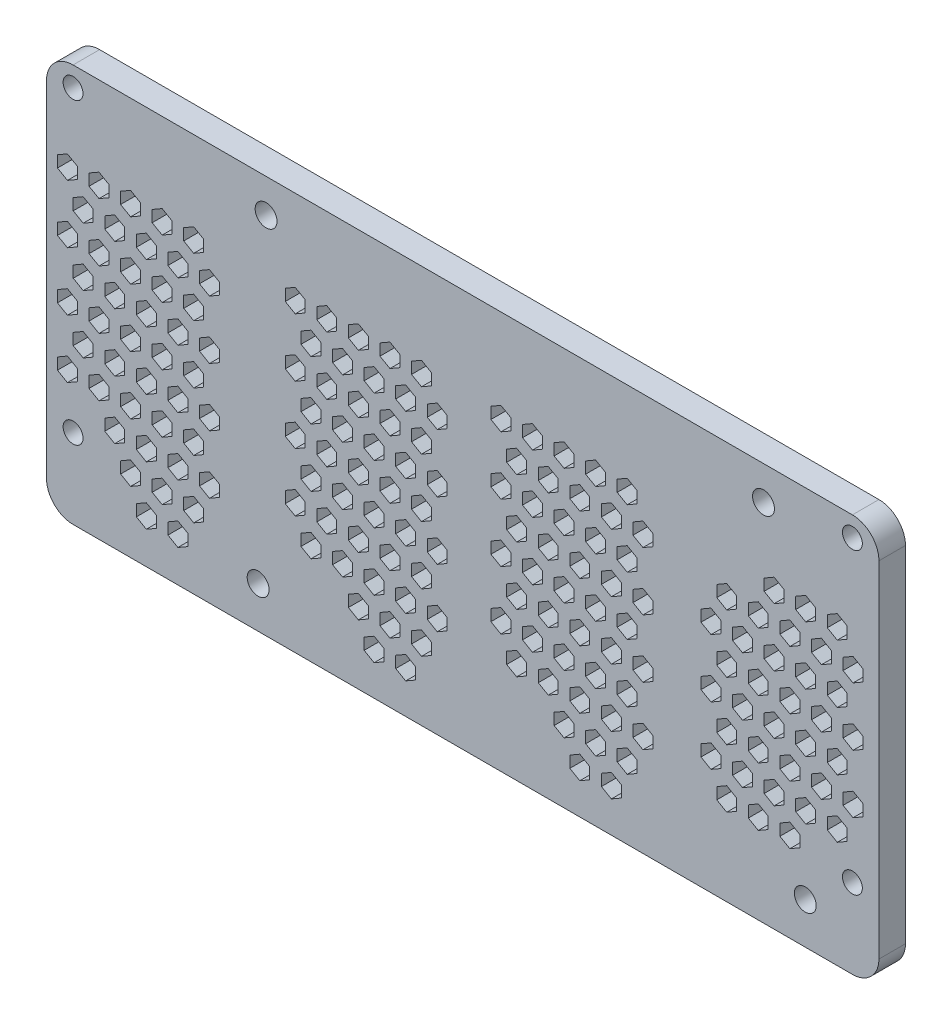
from build123d import *

# Parameters (mm, degrees)
SKETCH1_R           = 1.5
SKETCH1_R_2         = 1.65
BOSS_EXTRUDE5_DEPTH = 4


with BuildPart() as part:
    # Sketch1 → Boss-Extrude5 (new body)
    with BuildSketch(Plane.XY):
        with BuildLine():
            Line((-44, 25.588243638), (73.5, 25.588243638))
            ThreePointArc((73.5, 25.588243638), (76.328427125, 24.416670763), (77.5, 21.588243638))
            Line((77.5, 21.588243638), (77.5, -30.415198275))
            ThreePointArc((77.5, -30.415198275), (76.328427125, -33.2436254), (73.5, -34.415198275))
            Line((73.5, -34.415198275), (-44, -34.415198275))
            ThreePointArc((-44, -34.415198275), (-46.828427125, -33.2436254), (-48, -30.415198275))
            Line((-48, -30.415198275), (-48, 21.588243638))
            ThreePointArc((-48, 21.588243638), (-46.828427125, 24.416670763), (-44, 25.588243638))
        make_face()
        with Locations((-44, 22.588243638)):
            Circle(SKETCH1_R, mode=Mode.SUBTRACT)
        with Locations((73.5, 22.588243638)):
            Circle(SKETCH1_R, mode=Mode.SUBTRACT)
        with Locations((-44, -22.411756362)):
            Circle(SKETCH1_R, mode=Mode.SUBTRACT)
        with Locations((73.5, -22.411756362)):
            Circle(SKETCH1_R, mode=Mode.SUBTRACT)
        with Locations((-14.9, 20.514801725)):
            Circle(SKETCH1_R_2, mode=Mode.SUBTRACT)
        with Locations((-16.1, -28.185198275)):
            Circle(SKETCH1_R_2, mode=Mode.SUBTRACT)
        with Locations((60.1, 20.514801725)):
            Circle(SKETCH1_R_2, mode=Mode.SUBTRACT)
        with Locations((66.4, -28.185198275)):
            Circle(SKETCH1_R_2, mode=Mode.SUBTRACT)
        Polygon((-44.8542361, 13.546846171), (-46.3542361, 12.680820767), (-46.3542361, 10.948769959), (-44.8542361, 10.082744555), (-43.3542361, 10.948769959), (-43.3542361, 12.680820767), align=None, mode=Mode.SUBTRACT)
        Polygon((-42.478591753, 9.144922382), (-43.978591753, 8.278896978), (-43.978591753, 6.546846171), (-42.478591753, 5.680820767), (-40.978591753, 6.546846171), (-40.978591753, 8.278896978), align=None, mode=Mode.SUBTRACT)
        Polygon((-40.0942361, 13.546846171), (-41.5942361, 12.680820767), (-41.5942361, 10.948769959), (-40.0942361, 10.082744555), (-38.5942361, 10.948769959), (-38.5942361, 12.680820767), align=None, mode=Mode.SUBTRACT)
        Polygon((-37.718591753, 9.144922382), (-39.218591753, 8.278896978), (-39.218591753, 6.546846171), (-37.718591753, 5.680820767), (-36.218591753, 6.546846171), (-36.218591753, 8.278896978), align=None, mode=Mode.SUBTRACT)
        Polygon((-35.3342361, 13.546846171), (-36.8342361, 12.680820767), (-36.8342361, 10.948769959), (-35.3342361, 10.082744555), (-33.8342361, 10.948769959), (-33.8342361, 12.680820767), align=None, mode=Mode.SUBTRACT)
        Polygon((-32.958591753, 9.144922382), (-34.458591753, 8.278896978), (-34.458591753, 6.546846171), (-32.958591753, 5.680820767), (-31.458591753, 6.546846171), (-31.458591753, 8.278896978), align=None, mode=Mode.SUBTRACT)
        Polygon((-30.5742361, 13.546846171), (-32.0742361, 12.680820767), (-32.0742361, 10.948769959), (-30.5742361, 10.082744555), (-29.0742361, 10.948769959), (-29.0742361, 12.680820767), align=None, mode=Mode.SUBTRACT)
        Polygon((-28.198591753, 9.144922382), (-29.698591753, 8.278896978), (-29.698591753, 6.546846171), (-28.198591753, 5.680820767), (-26.698591753, 6.546846171), (-26.698591753, 8.278896978), align=None, mode=Mode.SUBTRACT)
        Polygon((-25.8142361, 13.546846171), (-27.3142361, 12.680820767), (-27.3142361, 10.948769959), (-25.8142361, 10.082744555), (-24.3142361, 10.948769959), (-24.3142361, 12.680820767), align=None, mode=Mode.SUBTRACT)
        Polygon((-23.438591753, 9.144922382), (-24.938591753, 8.278896978), (-24.938591753, 6.546846171), (-23.438591753, 5.680820767), (-21.938591753, 6.546846171), (-21.938591753, 8.278896978), align=None, mode=Mode.SUBTRACT)
        Polygon((-40.0942361, 4.746846171), (-41.5942361, 3.880820767), (-41.5942361, 2.148769959), (-40.0942361, 1.282744555), (-38.5942361, 2.148769959), (-38.5942361, 3.880820767), align=None, mode=Mode.SUBTRACT)
        Polygon((-37.718591753, 0.344922382), (-39.218591753, -0.521103022), (-39.218591753, -2.253153829), (-37.718591753, -3.119179233), (-36.218591753, -2.253153829), (-36.218591753, -0.521103022), align=None, mode=Mode.SUBTRACT)
        Polygon((-35.3342361, 4.746846171), (-36.8342361, 3.880820767), (-36.8342361, 2.148769959), (-35.3342361, 1.282744555), (-33.8342361, 2.148769959), (-33.8342361, 3.880820767), align=None, mode=Mode.SUBTRACT)
        Polygon((-32.958591753, 0.344922382), (-34.458591753, -0.521103022), (-34.458591753, -2.253153829), (-32.958591753, -3.119179233), (-31.458591753, -2.253153829), (-31.458591753, -0.521103022), align=None, mode=Mode.SUBTRACT)
        Polygon((-30.5742361, 4.746846171), (-32.0742361, 3.880820767), (-32.0742361, 2.148769959), (-30.5742361, 1.282744555), (-29.0742361, 2.148769959), (-29.0742361, 3.880820767), align=None, mode=Mode.SUBTRACT)
        Polygon((-28.198591753, 0.344922382), (-29.698591753, -0.521103022), (-29.698591753, -2.253153829), (-28.198591753, -3.119179233), (-26.698591753, -2.253153829), (-26.698591753, -0.521103022), align=None, mode=Mode.SUBTRACT)
        Polygon((-25.8142361, 4.746846171), (-27.3142361, 3.880820767), (-27.3142361, 2.148769959), (-25.8142361, 1.282744555), (-24.3142361, 2.148769959), (-24.3142361, 3.880820767), align=None, mode=Mode.SUBTRACT)
        Polygon((-23.438591753, 0.344922382), (-24.938591753, -0.521103022), (-24.938591753, -2.253153829), (-23.438591753, -3.119179233), (-21.938591753, -2.253153829), (-21.938591753, -0.521103022), align=None, mode=Mode.SUBTRACT)
        Polygon((-40.0942361, -4.053153829), (-41.5942361, -4.919179233), (-41.5942361, -6.651230041), (-40.0942361, -7.517255445), (-38.5942361, -6.651230041), (-38.5942361, -4.919179233), align=None, mode=Mode.SUBTRACT)
        Polygon((-37.718591753, -8.455077618), (-39.218591753, -9.321103022), (-39.218591753, -11.053153829), (-37.718591753, -11.919179233), (-36.218591753, -11.053153829), (-36.218591753, -9.321103022), align=None, mode=Mode.SUBTRACT)
        Polygon((-35.3342361, -4.053153829), (-36.8342361, -4.919179233), (-36.8342361, -6.651230041), (-35.3342361, -7.517255445), (-33.8342361, -6.651230041), (-33.8342361, -4.919179233), align=None, mode=Mode.SUBTRACT)
        Polygon((-32.958591753, -8.455077618), (-34.458591753, -9.321103022), (-34.458591753, -11.053153829), (-32.958591753, -11.919179233), (-31.458591753, -11.053153829), (-31.458591753, -9.321103022), align=None, mode=Mode.SUBTRACT)
        Polygon((-30.5742361, -4.053153829), (-32.0742361, -4.919179233), (-32.0742361, -6.651230041), (-30.5742361, -7.517255445), (-29.0742361, -6.651230041), (-29.0742361, -4.919179233), align=None, mode=Mode.SUBTRACT)
        Polygon((-28.198591753, -8.455077618), (-29.698591753, -9.321103022), (-29.698591753, -11.053153829), (-28.198591753, -11.919179233), (-26.698591753, -11.053153829), (-26.698591753, -9.321103022), align=None, mode=Mode.SUBTRACT)
        Polygon((-25.8142361, -4.053153829), (-27.3142361, -4.919179233), (-27.3142361, -6.651230041), (-25.8142361, -7.517255445), (-24.3142361, -6.651230041), (-24.3142361, -4.919179233), align=None, mode=Mode.SUBTRACT)
        Polygon((-23.438591753, -8.455077618), (-24.938591753, -9.321103022), (-24.938591753, -11.053153829), (-23.438591753, -11.919179233), (-21.938591753, -11.053153829), (-21.938591753, -9.321103022), align=None, mode=Mode.SUBTRACT)
        Polygon((-40.0942361, -12.853153829), (-41.5942361, -13.719179233), (-41.5942361, -15.451230041), (-40.0942361, -16.317255445), (-38.5942361, -15.451230041), (-38.5942361, -13.719179233), align=None, mode=Mode.SUBTRACT)
        Polygon((-37.718591753, -17.255077618), (-39.218591753, -18.121103022), (-39.218591753, -19.853153829), (-37.718591753, -20.719179233), (-36.218591753, -19.853153829), (-36.218591753, -18.121103022), align=None, mode=Mode.SUBTRACT)
        Polygon((-35.3342361, -12.853153829), (-36.8342361, -13.719179233), (-36.8342361, -15.451230041), (-35.3342361, -16.317255445), (-33.8342361, -15.451230041), (-33.8342361, -13.719179233), align=None, mode=Mode.SUBTRACT)
        Polygon((-32.958591753, -17.255077618), (-34.458591753, -18.121103022), (-34.458591753, -19.853153829), (-32.958591753, -20.719179233), (-31.458591753, -19.853153829), (-31.458591753, -18.121103022), align=None, mode=Mode.SUBTRACT)
        Polygon((-30.5742361, -12.853153829), (-32.0742361, -13.719179233), (-32.0742361, -15.451230041), (-30.5742361, -16.317255445), (-29.0742361, -15.451230041), (-29.0742361, -13.719179233), align=None, mode=Mode.SUBTRACT)
        Polygon((-28.198591753, -17.255077618), (-29.698591753, -18.121103022), (-29.698591753, -19.853153829), (-28.198591753, -20.719179233), (-26.698591753, -19.853153829), (-26.698591753, -18.121103022), align=None, mode=Mode.SUBTRACT)
        Polygon((-25.8142361, -12.853153829), (-27.3142361, -13.719179233), (-27.3142361, -15.451230041), (-25.8142361, -16.317255445), (-24.3142361, -15.451230041), (-24.3142361, -13.719179233), align=None, mode=Mode.SUBTRACT)
        Polygon((-23.438591753, -17.255077618), (-24.938591753, -18.121103022), (-24.938591753, -19.853153829), (-23.438591753, -20.719179233), (-21.938591753, -19.853153829), (-21.938591753, -18.121103022), align=None, mode=Mode.SUBTRACT)
        Polygon((-35.3342361, -21.653153829), (-36.8342361, -22.519179233), (-36.8342361, -24.251230041), (-35.3342361, -25.117255445), (-33.8342361, -24.251230041), (-33.8342361, -22.519179233), align=None, mode=Mode.SUBTRACT)
        Polygon((-32.958591753, -26.055077618), (-34.458591753, -26.921103022), (-34.458591753, -28.653153829), (-32.958591753, -29.519179233), (-31.458591753, -28.653153829), (-31.458591753, -26.921103022), align=None, mode=Mode.SUBTRACT)
        Polygon((-30.5742361, -21.653153829), (-32.0742361, -22.519179233), (-32.0742361, -24.251230041), (-30.5742361, -25.117255445), (-29.0742361, -24.251230041), (-29.0742361, -22.519179233), align=None, mode=Mode.SUBTRACT)
        Polygon((-28.198591753, -26.055077618), (-29.698591753, -26.921103022), (-29.698591753, -28.653153829), (-28.198591753, -29.519179233), (-26.698591753, -28.653153829), (-26.698591753, -26.921103022), align=None, mode=Mode.SUBTRACT)
        Polygon((-25.8142361, -21.653153829), (-27.3142361, -22.519179233), (-27.3142361, -24.251230041), (-25.8142361, -25.117255445), (-24.3142361, -24.251230041), (-24.3142361, -22.519179233), align=None, mode=Mode.SUBTRACT)
        Polygon((-44.8542361, 4.746846171), (-46.3542361, 3.880820767), (-46.3542361, 2.148769959), (-44.8542361, 1.282744555), (-43.3542361, 2.148769959), (-43.3542361, 3.880820767), align=None, mode=Mode.SUBTRACT)
        Polygon((-42.478591753, 0.344922382), (-43.978591753, -0.521103022), (-43.978591753, -2.253153829), (-42.478591753, -3.119179233), (-40.978591753, -2.253153829), (-40.978591753, -0.521103022), align=None, mode=Mode.SUBTRACT)
        Polygon((-44.8542361, -4.053153829), (-46.3542361, -4.919179233), (-46.3542361, -6.651230041), (-44.8542361, -7.517255445), (-43.3542361, -6.651230041), (-43.3542361, -4.919179233), align=None, mode=Mode.SUBTRACT)
        Polygon((-42.478591753, -8.455077618), (-43.978591753, -9.321103022), (-43.978591753, -11.053153829), (-42.478591753, -11.919179233), (-40.978591753, -11.053153829), (-40.978591753, -9.321103022), align=None, mode=Mode.SUBTRACT)
        Polygon((-44.8542361, -12.853153829), (-46.3542361, -13.719179233), (-46.3542361, -15.451230041), (-44.8542361, -16.317255445), (-43.3542361, -15.451230041), (-43.3542361, -13.719179233), align=None, mode=Mode.SUBTRACT)
        Polygon((54.553412934, 7.152031374), (53.053412934, 6.28600597), (53.053412934, 4.553955163), (54.553412934, 3.687929759), (56.053412934, 4.553955163), (56.053412934, 6.28600597), align=None, mode=Mode.SUBTRACT)
        Polygon((59.313412934, 7.152031374), (57.813412934, 6.28600597), (57.813412934, 4.553955163), (59.313412934, 3.687929759), (60.813412934, 4.553955163), (60.813412934, 6.28600597), align=None, mode=Mode.SUBTRACT)
        Polygon((61.697768587, 11.553955163), (60.197768587, 10.687929759), (60.197768587, 8.955878952), (61.697768587, 8.089853548), (63.197768587, 8.955878952), (63.197768587, 10.687929759), align=None, mode=Mode.SUBTRACT)
        Polygon((64.073412934, 7.152031374), (62.573412934, 6.28600597), (62.573412934, 4.553955163), (64.073412934, 3.687929759), (65.573412934, 4.553955163), (65.573412934, 6.28600597), align=None, mode=Mode.SUBTRACT)
        Polygon((66.457768587, 11.553955163), (64.957768587, 10.687929759), (64.957768587, 8.955878952), (66.457768587, 8.089853548), (67.957768587, 8.955878952), (67.957768587, 10.687929759), align=None, mode=Mode.SUBTRACT)
        Polygon((68.833412934, 7.152031374), (67.333412934, 6.28600597), (67.333412934, 4.553955163), (68.833412934, 3.687929759), (70.333412934, 4.553955163), (70.333412934, 6.28600597), align=None, mode=Mode.SUBTRACT)
        Polygon((71.217768587, 11.553955163), (69.717768587, 10.687929759), (69.717768587, 8.955878952), (71.217768587, 8.089853548), (72.717768587, 8.955878952), (72.717768587, 10.687929759), align=None, mode=Mode.SUBTRACT)
        Polygon((73.593412934, 7.152031374), (72.093412934, 6.28600597), (72.093412934, 4.553955163), (73.593412934, 3.687929759), (75.093412934, 4.553955163), (75.093412934, 6.28600597), align=None, mode=Mode.SUBTRACT)
        Polygon((56.937768587, 2.753955163), (55.437768587, 1.887929759), (55.437768587, 0.155878952), (56.937768587, -0.710146452), (58.437768587, 0.155878952), (58.437768587, 1.887929759), align=None, mode=Mode.SUBTRACT)
        Polygon((59.313412934, -1.647968626), (57.813412934, -2.51399403), (57.813412934, -4.246044837), (59.313412934, -5.112070241), (60.813412934, -4.246044837), (60.813412934, -2.51399403), align=None, mode=Mode.SUBTRACT)
        Polygon((61.697768587, 2.753955163), (60.197768587, 1.887929759), (60.197768587, 0.155878952), (61.697768587, -0.710146452), (63.197768587, 0.155878952), (63.197768587, 1.887929759), align=None, mode=Mode.SUBTRACT)
        Polygon((64.073412934, -1.647968626), (62.573412934, -2.51399403), (62.573412934, -4.246044837), (64.073412934, -5.112070241), (65.573412934, -4.246044837), (65.573412934, -2.51399403), align=None, mode=Mode.SUBTRACT)
        Polygon((66.457768587, 2.753955163), (64.957768587, 1.887929759), (64.957768587, 0.155878952), (66.457768587, -0.710146452), (67.957768587, 0.155878952), (67.957768587, 1.887929759), align=None, mode=Mode.SUBTRACT)
        Polygon((68.833412934, -1.647968626), (67.333412934, -2.51399403), (67.333412934, -4.246044837), (68.833412934, -5.112070241), (70.333412934, -4.246044837), (70.333412934, -2.51399403), align=None, mode=Mode.SUBTRACT)
        Polygon((71.217768587, 2.753955163), (69.717768587, 1.887929759), (69.717768587, 0.155878952), (71.217768587, -0.710146452), (72.717768587, 0.155878952), (72.717768587, 1.887929759), align=None, mode=Mode.SUBTRACT)
        Polygon((73.593412934, -1.647968626), (72.093412934, -2.51399403), (72.093412934, -4.246044837), (73.593412934, -5.112070241), (75.093412934, -4.246044837), (75.093412934, -2.51399403), align=None, mode=Mode.SUBTRACT)
        Polygon((56.937768587, -6.046044837), (55.437768587, -6.912070241), (55.437768587, -8.644121048), (56.937768587, -9.510146452), (58.437768587, -8.644121048), (58.437768587, -6.912070241), align=None, mode=Mode.SUBTRACT)
        Polygon((59.313412934, -10.447968626), (57.813412934, -11.31399403), (57.813412934, -13.046044837), (59.313412934, -13.912070241), (60.813412934, -13.046044837), (60.813412934, -11.31399403), align=None, mode=Mode.SUBTRACT)
        Polygon((61.697768587, -6.046044837), (60.197768587, -6.912070241), (60.197768587, -8.644121048), (61.697768587, -9.510146452), (63.197768587, -8.644121048), (63.197768587, -6.912070241), align=None, mode=Mode.SUBTRACT)
        Polygon((64.073412934, -10.447968626), (62.573412934, -11.31399403), (62.573412934, -13.046044837), (64.073412934, -13.912070241), (65.573412934, -13.046044837), (65.573412934, -11.31399403), align=None, mode=Mode.SUBTRACT)
        Polygon((66.457768587, -6.046044837), (64.957768587, -6.912070241), (64.957768587, -8.644121048), (66.457768587, -9.510146452), (67.957768587, -8.644121048), (67.957768587, -6.912070241), align=None, mode=Mode.SUBTRACT)
        Polygon((68.833412934, -10.447968626), (67.333412934, -11.31399403), (67.333412934, -13.046044837), (68.833412934, -13.912070241), (70.333412934, -13.046044837), (70.333412934, -11.31399403), align=None, mode=Mode.SUBTRACT)
        Polygon((71.217768587, -6.046044837), (69.717768587, -6.912070241), (69.717768587, -8.644121048), (71.217768587, -9.510146452), (72.717768587, -8.644121048), (72.717768587, -6.912070241), align=None, mode=Mode.SUBTRACT)
        Polygon((73.593412934, -10.447968626), (72.093412934, -11.31399403), (72.093412934, -13.046044837), (73.593412934, -13.912070241), (75.093412934, -13.046044837), (75.093412934, -11.31399403), align=None, mode=Mode.SUBTRACT)
        Polygon((56.937768587, -14.846044837), (55.437768587, -15.712070241), (55.437768587, -17.444121048), (56.937768587, -18.310146452), (58.437768587, -17.444121048), (58.437768587, -15.712070241), align=None, mode=Mode.SUBTRACT)
        Polygon((59.313412934, -19.247968626), (57.813412934, -20.11399403), (57.813412934, -21.846044837), (59.313412934, -22.712070241), (60.813412934, -21.846044837), (60.813412934, -20.11399403), align=None, mode=Mode.SUBTRACT)
        Polygon((61.697768587, -14.846044837), (60.197768587, -15.712070241), (60.197768587, -17.444121048), (61.697768587, -18.310146452), (63.197768587, -17.444121048), (63.197768587, -15.712070241), align=None, mode=Mode.SUBTRACT)
        Polygon((64.073412934, -19.247968626), (62.573412934, -20.11399403), (62.573412934, -21.846044837), (64.073412934, -22.712070241), (65.573412934, -21.846044837), (65.573412934, -20.11399403), align=None, mode=Mode.SUBTRACT)
        Polygon((66.457768587, -14.846044837), (64.957768587, -15.712070241), (64.957768587, -17.444121048), (66.457768587, -18.310146452), (67.957768587, -17.444121048), (67.957768587, -15.712070241), align=None, mode=Mode.SUBTRACT)
        Polygon((71.217768587, -14.846044837), (69.717768587, -15.712070241), (69.717768587, -17.444121048), (71.217768587, -18.310146452), (72.717768587, -17.444121048), (72.717768587, -15.712070241), align=None, mode=Mode.SUBTRACT)
        Polygon((52.177768587, 2.753955163), (50.677768587, 1.887929759), (50.677768587, 0.155878952), (52.177768587, -0.710146452), (53.677768587, 0.155878952), (53.677768587, 1.887929759), align=None, mode=Mode.SUBTRACT)
        Polygon((54.553412934, -1.647968626), (53.053412934, -2.51399403), (53.053412934, -4.246044837), (54.553412934, -5.112070241), (56.053412934, -4.246044837), (56.053412934, -2.51399403), align=None, mode=Mode.SUBTRACT)
        Polygon((52.177768587, -6.046044837), (50.677768587, -6.912070241), (50.677768587, -8.644121048), (52.177768587, -9.510146452), (53.677768587, -8.644121048), (53.677768587, -6.912070241), align=None, mode=Mode.SUBTRACT)
        Polygon((54.553412934, -10.447968626), (53.053412934, -11.31399403), (53.053412934, -13.046044837), (54.553412934, -13.912070241), (56.053412934, -13.046044837), (56.053412934, -11.31399403), align=None, mode=Mode.SUBTRACT)
        Polygon((52.177768587, -14.846044837), (50.677768587, -15.712070241), (50.677768587, -17.444121048), (52.177768587, -18.310146452), (53.677768587, -17.444121048), (53.677768587, -15.712070241), align=None, mode=Mode.SUBTRACT)
        Polygon((54.553412934, -19.247968626), (53.053412934, -20.11399403), (53.053412934, -21.846044837), (54.553412934, -22.712070241), (56.053412934, -21.846044837), (56.053412934, -20.11399403), align=None, mode=Mode.SUBTRACT)
        Polygon((-10.509250981, 13.292308193), (-12.009250981, 12.426282789), (-12.009250981, 10.694231982), (-10.509250981, 9.828206578), (-9.009250981, 10.694231982), (-9.009250981, 12.426282789), align=None, mode=Mode.SUBTRACT)
        Polygon((-8.133606634, 8.890384404), (-9.633606634, 8.024359001), (-9.633606634, 6.292308193), (-8.133606634, 5.426282789), (-6.633606634, 6.292308193), (-6.633606634, 8.024359001), align=None, mode=Mode.SUBTRACT)
        Polygon((-5.749250981, 13.292308193), (-7.249250981, 12.426282789), (-7.249250981, 10.694231982), (-5.749250981, 9.828206578), (-4.249250981, 10.694231982), (-4.249250981, 12.426282789), align=None, mode=Mode.SUBTRACT)
        Polygon((-3.373606634, 8.890384404), (-4.873606634, 8.024359001), (-4.873606634, 6.292308193), (-3.373606634, 5.426282789), (-1.873606634, 6.292308193), (-1.873606634, 8.024359001), align=None, mode=Mode.SUBTRACT)
        Polygon((-0.989250981, 13.292308193), (-2.489250981, 12.426282789), (-2.489250981, 10.694231982), (-0.989250981, 9.828206578), (0.510749019, 10.694231982), (0.510749019, 12.426282789), align=None, mode=Mode.SUBTRACT)
        Polygon((1.386393366, 8.890384404), (-0.113606634, 8.024359001), (-0.113606634, 6.292308193), (1.386393366, 5.426282789), (2.886393366, 6.292308193), (2.886393366, 8.024359001), align=None, mode=Mode.SUBTRACT)
        Polygon((3.770749019, 13.292308193), (2.270749019, 12.426282789), (2.270749019, 10.694231982), (3.770749019, 9.828206578), (5.270749019, 10.694231982), (5.270749019, 12.426282789), align=None, mode=Mode.SUBTRACT)
        Polygon((6.146393366, 8.890384404), (4.646393366, 8.024359001), (4.646393366, 6.292308193), (6.146393366, 5.426282789), (7.646393366, 6.292308193), (7.646393366, 8.024359001), align=None, mode=Mode.SUBTRACT)
        Polygon((8.530749019, 13.292308193), (7.030749019, 12.426282789), (7.030749019, 10.694231982), (8.530749019, 9.828206578), (10.030749019, 10.694231982), (10.030749019, 12.426282789), align=None, mode=Mode.SUBTRACT)
        Polygon((10.906393366, 8.890384404), (9.406393366, 8.024359001), (9.406393366, 6.292308193), (10.906393366, 5.426282789), (12.406393366, 6.292308193), (12.406393366, 8.024359001), align=None, mode=Mode.SUBTRACT)
        Polygon((-5.749250981, 4.492308193), (-7.249250981, 3.626282789), (-7.249250981, 1.894231982), (-5.749250981, 1.028206578), (-4.249250981, 1.894231982), (-4.249250981, 3.626282789), align=None, mode=Mode.SUBTRACT)
        Polygon((-3.373606634, 0.090384404), (-4.873606634, -0.775640999), (-4.873606634, -2.507691807), (-3.373606634, -3.373717211), (-1.873606634, -2.507691807), (-1.873606634, -0.775640999), align=None, mode=Mode.SUBTRACT)
        Polygon((-0.989250981, 4.492308193), (-2.489250981, 3.626282789), (-2.489250981, 1.894231982), (-0.989250981, 1.028206578), (0.510749019, 1.894231982), (0.510749019, 3.626282789), align=None, mode=Mode.SUBTRACT)
        Polygon((1.386393366, 0.090384404), (-0.113606634, -0.775640999), (-0.113606634, -2.507691807), (1.386393366, -3.373717211), (2.886393366, -2.507691807), (2.886393366, -0.775640999), align=None, mode=Mode.SUBTRACT)
        Polygon((3.770749019, 4.492308193), (2.270749019, 3.626282789), (2.270749019, 1.894231982), (3.770749019, 1.028206578), (5.270749019, 1.894231982), (5.270749019, 3.626282789), align=None, mode=Mode.SUBTRACT)
        Polygon((6.146393366, 0.090384404), (4.646393366, -0.775640999), (4.646393366, -2.507691807), (6.146393366, -3.373717211), (7.646393366, -2.507691807), (7.646393366, -0.775640999), align=None, mode=Mode.SUBTRACT)
        Polygon((8.530749019, 4.492308193), (7.030749019, 3.626282789), (7.030749019, 1.894231982), (8.530749019, 1.028206578), (10.030749019, 1.894231982), (10.030749019, 3.626282789), align=None, mode=Mode.SUBTRACT)
        Polygon((10.906393366, 0.090384404), (9.406393366, -0.775640999), (9.406393366, -2.507691807), (10.906393366, -3.373717211), (12.406393366, -2.507691807), (12.406393366, -0.775640999), align=None, mode=Mode.SUBTRACT)
        Polygon((-5.749250981, -4.307691807), (-7.249250981, -5.173717211), (-7.249250981, -6.905768018), (-5.749250981, -7.771793422), (-4.249250981, -6.905768018), (-4.249250981, -5.173717211), align=None, mode=Mode.SUBTRACT)
        Polygon((-3.373606634, -8.709615596), (-4.873606634, -9.575640999), (-4.873606634, -11.307691807), (-3.373606634, -12.173717211), (-1.873606634, -11.307691807), (-1.873606634, -9.575640999), align=None, mode=Mode.SUBTRACT)
        Polygon((-0.989250981, -4.307691807), (-2.489250981, -5.173717211), (-2.489250981, -6.905768018), (-0.989250981, -7.771793422), (0.510749019, -6.905768018), (0.510749019, -5.173717211), align=None, mode=Mode.SUBTRACT)
        Polygon((1.386393366, -8.709615596), (-0.113606634, -9.575640999), (-0.113606634, -11.307691807), (1.386393366, -12.173717211), (2.886393366, -11.307691807), (2.886393366, -9.575640999), align=None, mode=Mode.SUBTRACT)
        Polygon((3.770749019, -4.307691807), (2.270749019, -5.173717211), (2.270749019, -6.905768018), (3.770749019, -7.771793422), (5.270749019, -6.905768018), (5.270749019, -5.173717211), align=None, mode=Mode.SUBTRACT)
        Polygon((6.146393366, -8.709615596), (4.646393366, -9.575640999), (4.646393366, -11.307691807), (6.146393366, -12.173717211), (7.646393366, -11.307691807), (7.646393366, -9.575640999), align=None, mode=Mode.SUBTRACT)
        Polygon((8.530749019, -4.307691807), (7.030749019, -5.173717211), (7.030749019, -6.905768018), (8.530749019, -7.771793422), (10.030749019, -6.905768018), (10.030749019, -5.173717211), align=None, mode=Mode.SUBTRACT)
        Polygon((10.906393366, -8.709615596), (9.406393366, -9.575640999), (9.406393366, -11.307691807), (10.906393366, -12.173717211), (12.406393366, -11.307691807), (12.406393366, -9.575640999), align=None, mode=Mode.SUBTRACT)
        Polygon((-5.749250981, -13.107691807), (-7.249250981, -13.973717211), (-7.249250981, -15.705768018), (-5.749250981, -16.571793422), (-4.249250981, -15.705768018), (-4.249250981, -13.973717211), align=None, mode=Mode.SUBTRACT)
        Polygon((-3.373606634, -17.509615596), (-4.873606634, -18.375640999), (-4.873606634, -20.107691807), (-3.373606634, -20.973717211), (-1.873606634, -20.107691807), (-1.873606634, -18.375640999), align=None, mode=Mode.SUBTRACT)
        Polygon((-0.989250981, -13.107691807), (-2.489250981, -13.973717211), (-2.489250981, -15.705768018), (-0.989250981, -16.571793422), (0.510749019, -15.705768018), (0.510749019, -13.973717211), align=None, mode=Mode.SUBTRACT)
        Polygon((1.386393366, -17.509615596), (-0.113606634, -18.375640999), (-0.113606634, -20.107691807), (1.386393366, -20.973717211), (2.886393366, -20.107691807), (2.886393366, -18.375640999), align=None, mode=Mode.SUBTRACT)
        Polygon((3.770749019, -13.107691807), (2.270749019, -13.973717211), (2.270749019, -15.705768018), (3.770749019, -16.571793422), (5.270749019, -15.705768018), (5.270749019, -13.973717211), align=None, mode=Mode.SUBTRACT)
        Polygon((6.146393366, -17.509615596), (4.646393366, -18.375640999), (4.646393366, -20.107691807), (6.146393366, -20.973717211), (7.646393366, -20.107691807), (7.646393366, -18.375640999), align=None, mode=Mode.SUBTRACT)
        Polygon((8.530749019, -13.107691807), (7.030749019, -13.973717211), (7.030749019, -15.705768018), (8.530749019, -16.571793422), (10.030749019, -15.705768018), (10.030749019, -13.973717211), align=None, mode=Mode.SUBTRACT)
        Polygon((10.906393366, -17.509615596), (9.406393366, -18.375640999), (9.406393366, -20.107691807), (10.906393366, -20.973717211), (12.406393366, -20.107691807), (12.406393366, -18.375640999), align=None, mode=Mode.SUBTRACT)
        Polygon((-0.989250981, -21.907691807), (-2.489250981, -22.773717211), (-2.489250981, -24.505768018), (-0.989250981, -25.371793422), (0.510749019, -24.505768018), (0.510749019, -22.773717211), align=None, mode=Mode.SUBTRACT)
        Polygon((1.386393366, -26.309615596), (-0.113606634, -27.175640999), (-0.113606634, -28.907691807), (1.386393366, -29.773717211), (2.886393366, -28.907691807), (2.886393366, -27.175640999), align=None, mode=Mode.SUBTRACT)
        Polygon((3.770749019, -21.907691807), (2.270749019, -22.773717211), (2.270749019, -24.505768018), (3.770749019, -25.371793422), (5.270749019, -24.505768018), (5.270749019, -22.773717211), align=None, mode=Mode.SUBTRACT)
        Polygon((6.146393366, -26.309615596), (4.646393366, -27.175640999), (4.646393366, -28.907691807), (6.146393366, -29.773717211), (7.646393366, -28.907691807), (7.646393366, -27.175640999), align=None, mode=Mode.SUBTRACT)
        Polygon((8.530749019, -21.907691807), (7.030749019, -22.773717211), (7.030749019, -24.505768018), (8.530749019, -25.371793422), (10.030749019, -24.505768018), (10.030749019, -22.773717211), align=None, mode=Mode.SUBTRACT)
        Polygon((-10.509250981, 4.492308193), (-12.009250981, 3.626282789), (-12.009250981, 1.894231982), (-10.509250981, 1.028206578), (-9.009250981, 1.894231982), (-9.009250981, 3.626282789), align=None, mode=Mode.SUBTRACT)
        Polygon((-8.133606634, 0.090384404), (-9.633606634, -0.775640999), (-9.633606634, -2.507691807), (-8.133606634, -3.373717211), (-6.633606634, -2.507691807), (-6.633606634, -0.775640999), align=None, mode=Mode.SUBTRACT)
        Polygon((-10.509250981, -4.307691807), (-12.009250981, -5.173717211), (-12.009250981, -6.905768018), (-10.509250981, -7.771793422), (-9.009250981, -6.905768018), (-9.009250981, -5.173717211), align=None, mode=Mode.SUBTRACT)
        Polygon((-8.133606634, -8.709615596), (-9.633606634, -9.575640999), (-9.633606634, -11.307691807), (-8.133606634, -12.173717211), (-6.633606634, -11.307691807), (-6.633606634, -9.575640999), align=None, mode=Mode.SUBTRACT)
        Polygon((-10.509250981, -13.107691807), (-12.009250981, -13.973717211), (-12.009250981, -15.705768018), (-10.509250981, -16.571793422), (-9.009250981, -15.705768018), (-9.009250981, -13.973717211), align=None, mode=Mode.SUBTRACT)
        Polygon((-8.133606634, -17.509615596), (-9.633606634, -18.375640999), (-9.633606634, -20.107691807), (-8.133606634, -20.973717211), (-6.633606634, -20.107691807), (-6.633606634, -18.375640999), align=None, mode=Mode.SUBTRACT)
        Polygon((20.504407611, 13.391172594), (19.004407611, 12.525147191), (19.004407611, 10.793096383), (20.504407611, 9.927070979), (22.004407611, 10.793096383), (22.004407611, 12.525147191), align=None, mode=Mode.SUBTRACT)
        Polygon((22.880051958, 8.989248806), (21.380051958, 8.123223402), (21.380051958, 6.391172594), (22.880051958, 5.525147191), (24.380051958, 6.391172594), (24.380051958, 8.123223402), align=None, mode=Mode.SUBTRACT)
        Polygon((25.264407611, 13.391172594), (23.764407611, 12.525147191), (23.764407611, 10.793096383), (25.264407611, 9.927070979), (26.764407611, 10.793096383), (26.764407611, 12.525147191), align=None, mode=Mode.SUBTRACT)
        Polygon((27.640051958, 8.989248806), (26.140051958, 8.123223402), (26.140051958, 6.391172594), (27.640051958, 5.525147191), (29.140051958, 6.391172594), (29.140051958, 8.123223402), align=None, mode=Mode.SUBTRACT)
        Polygon((30.024407611, 13.391172594), (28.524407611, 12.525147191), (28.524407611, 10.793096383), (30.024407611, 9.927070979), (31.524407611, 10.793096383), (31.524407611, 12.525147191), align=None, mode=Mode.SUBTRACT)
        Polygon((32.400051958, 8.989248806), (30.900051958, 8.123223402), (30.900051958, 6.391172594), (32.400051958, 5.525147191), (33.900051958, 6.391172594), (33.900051958, 8.123223402), align=None, mode=Mode.SUBTRACT)
        Polygon((34.784407611, 13.391172594), (33.284407611, 12.525147191), (33.284407611, 10.793096383), (34.784407611, 9.927070979), (36.284407611, 10.793096383), (36.284407611, 12.525147191), align=None, mode=Mode.SUBTRACT)
        Polygon((37.160051958, 8.989248806), (35.660051958, 8.123223402), (35.660051958, 6.391172594), (37.160051958, 5.525147191), (38.660051958, 6.391172594), (38.660051958, 8.123223402), align=None, mode=Mode.SUBTRACT)
        Polygon((39.544407611, 13.391172594), (38.044407611, 12.525147191), (38.044407611, 10.793096383), (39.544407611, 9.927070979), (41.044407611, 10.793096383), (41.044407611, 12.525147191), align=None, mode=Mode.SUBTRACT)
        Polygon((41.920051958, 8.989248806), (40.420051958, 8.123223402), (40.420051958, 6.391172594), (41.920051958, 5.525147191), (43.420051958, 6.391172594), (43.420051958, 8.123223402), align=None, mode=Mode.SUBTRACT)
        Polygon((25.264407611, 4.591172594), (23.764407611, 3.725147191), (23.764407611, 1.993096383), (25.264407611, 1.127070979), (26.764407611, 1.993096383), (26.764407611, 3.725147191), align=None, mode=Mode.SUBTRACT)
        Polygon((27.640051958, 0.189248806), (26.140051958, -0.676776598), (26.140051958, -2.408827406), (27.640051958, -3.274852809), (29.140051958, -2.408827406), (29.140051958, -0.676776598), align=None, mode=Mode.SUBTRACT)
        Polygon((30.024407611, 4.591172594), (28.524407611, 3.725147191), (28.524407611, 1.993096383), (30.024407611, 1.127070979), (31.524407611, 1.993096383), (31.524407611, 3.725147191), align=None, mode=Mode.SUBTRACT)
        Polygon((32.400051958, 0.189248806), (30.900051958, -0.676776598), (30.900051958, -2.408827406), (32.400051958, -3.274852809), (33.900051958, -2.408827406), (33.900051958, -0.676776598), align=None, mode=Mode.SUBTRACT)
        Polygon((34.784407611, 4.591172594), (33.284407611, 3.725147191), (33.284407611, 1.993096383), (34.784407611, 1.127070979), (36.284407611, 1.993096383), (36.284407611, 3.725147191), align=None, mode=Mode.SUBTRACT)
        Polygon((37.160051958, 0.189248806), (35.660051958, -0.676776598), (35.660051958, -2.408827406), (37.160051958, -3.274852809), (38.660051958, -2.408827406), (38.660051958, -0.676776598), align=None, mode=Mode.SUBTRACT)
        Polygon((39.544407611, 4.591172594), (38.044407611, 3.725147191), (38.044407611, 1.993096383), (39.544407611, 1.127070979), (41.044407611, 1.993096383), (41.044407611, 3.725147191), align=None, mode=Mode.SUBTRACT)
        Polygon((41.920051958, 0.189248806), (40.420051958, -0.676776598), (40.420051958, -2.408827406), (41.920051958, -3.274852809), (43.420051958, -2.408827406), (43.420051958, -0.676776598), align=None, mode=Mode.SUBTRACT)
        Polygon((25.264407611, -4.208827406), (23.764407611, -5.074852809), (23.764407611, -6.806903617), (25.264407611, -7.672929021), (26.764407611, -6.806903617), (26.764407611, -5.074852809), align=None, mode=Mode.SUBTRACT)
        Polygon((27.640051958, -8.610751194), (26.140051958, -9.476776598), (26.140051958, -11.208827406), (27.640051958, -12.074852809), (29.140051958, -11.208827406), (29.140051958, -9.476776598), align=None, mode=Mode.SUBTRACT)
        Polygon((30.024407611, -4.208827406), (28.524407611, -5.074852809), (28.524407611, -6.806903617), (30.024407611, -7.672929021), (31.524407611, -6.806903617), (31.524407611, -5.074852809), align=None, mode=Mode.SUBTRACT)
        Polygon((32.400051958, -8.610751194), (30.900051958, -9.476776598), (30.900051958, -11.208827406), (32.400051958, -12.074852809), (33.900051958, -11.208827406), (33.900051958, -9.476776598), align=None, mode=Mode.SUBTRACT)
        Polygon((34.784407611, -4.208827406), (33.284407611, -5.074852809), (33.284407611, -6.806903617), (34.784407611, -7.672929021), (36.284407611, -6.806903617), (36.284407611, -5.074852809), align=None, mode=Mode.SUBTRACT)
        Polygon((37.160051958, -8.610751194), (35.660051958, -9.476776598), (35.660051958, -11.208827406), (37.160051958, -12.074852809), (38.660051958, -11.208827406), (38.660051958, -9.476776598), align=None, mode=Mode.SUBTRACT)
        Polygon((39.544407611, -4.208827406), (38.044407611, -5.074852809), (38.044407611, -6.806903617), (39.544407611, -7.672929021), (41.044407611, -6.806903617), (41.044407611, -5.074852809), align=None, mode=Mode.SUBTRACT)
        Polygon((41.920051958, -8.610751194), (40.420051958, -9.476776598), (40.420051958, -11.208827406), (41.920051958, -12.074852809), (43.420051958, -11.208827406), (43.420051958, -9.476776598), align=None, mode=Mode.SUBTRACT)
        Polygon((25.264407611, -13.008827406), (23.764407611, -13.874852809), (23.764407611, -15.606903617), (25.264407611, -16.472929021), (26.764407611, -15.606903617), (26.764407611, -13.874852809), align=None, mode=Mode.SUBTRACT)
        Polygon((27.640051958, -17.410751194), (26.140051958, -18.276776598), (26.140051958, -20.008827406), (27.640051958, -20.874852809), (29.140051958, -20.008827406), (29.140051958, -18.276776598), align=None, mode=Mode.SUBTRACT)
        Polygon((30.024407611, -13.008827406), (28.524407611, -13.874852809), (28.524407611, -15.606903617), (30.024407611, -16.472929021), (31.524407611, -15.606903617), (31.524407611, -13.874852809), align=None, mode=Mode.SUBTRACT)
        Polygon((32.400051958, -17.410751194), (30.900051958, -18.276776598), (30.900051958, -20.008827406), (32.400051958, -20.874852809), (33.900051958, -20.008827406), (33.900051958, -18.276776598), align=None, mode=Mode.SUBTRACT)
        Polygon((34.784407611, -13.008827406), (33.284407611, -13.874852809), (33.284407611, -15.606903617), (34.784407611, -16.472929021), (36.284407611, -15.606903617), (36.284407611, -13.874852809), align=None, mode=Mode.SUBTRACT)
        Polygon((37.160051958, -17.410751194), (35.660051958, -18.276776598), (35.660051958, -20.008827406), (37.160051958, -20.874852809), (38.660051958, -20.008827406), (38.660051958, -18.276776598), align=None, mode=Mode.SUBTRACT)
        Polygon((39.544407611, -13.008827406), (38.044407611, -13.874852809), (38.044407611, -15.606903617), (39.544407611, -16.472929021), (41.044407611, -15.606903617), (41.044407611, -13.874852809), align=None, mode=Mode.SUBTRACT)
        Polygon((41.920051958, -17.410751194), (40.420051958, -18.276776598), (40.420051958, -20.008827406), (41.920051958, -20.874852809), (43.420051958, -20.008827406), (43.420051958, -18.276776598), align=None, mode=Mode.SUBTRACT)
        Polygon((30.024407611, -21.808827406), (28.524407611, -22.674852809), (28.524407611, -24.406903617), (30.024407611, -25.272929021), (31.524407611, -24.406903617), (31.524407611, -22.674852809), align=None, mode=Mode.SUBTRACT)
        Polygon((32.400051958, -26.210751194), (30.900051958, -27.076776598), (30.900051958, -28.808827406), (32.400051958, -29.674852809), (33.900051958, -28.808827406), (33.900051958, -27.076776598), align=None, mode=Mode.SUBTRACT)
        Polygon((34.784407611, -21.808827406), (33.284407611, -22.674852809), (33.284407611, -24.406903617), (34.784407611, -25.272929021), (36.284407611, -24.406903617), (36.284407611, -22.674852809), align=None, mode=Mode.SUBTRACT)
        Polygon((37.160051958, -26.210751194), (35.660051958, -27.076776598), (35.660051958, -28.808827406), (37.160051958, -29.674852809), (38.660051958, -28.808827406), (38.660051958, -27.076776598), align=None, mode=Mode.SUBTRACT)
        Polygon((39.544407611, -21.808827406), (38.044407611, -22.674852809), (38.044407611, -24.406903617), (39.544407611, -25.272929021), (41.044407611, -24.406903617), (41.044407611, -22.674852809), align=None, mode=Mode.SUBTRACT)
        Polygon((20.504407611, 4.591172594), (19.004407611, 3.725147191), (19.004407611, 1.993096383), (20.504407611, 1.127070979), (22.004407611, 1.993096383), (22.004407611, 3.725147191), align=None, mode=Mode.SUBTRACT)
        Polygon((22.880051958, 0.189248806), (21.380051958, -0.676776598), (21.380051958, -2.408827406), (22.880051958, -3.274852809), (24.380051958, -2.408827406), (24.380051958, -0.676776598), align=None, mode=Mode.SUBTRACT)
        Polygon((20.504407611, -4.208827406), (19.004407611, -5.074852809), (19.004407611, -6.806903617), (20.504407611, -7.672929021), (22.004407611, -6.806903617), (22.004407611, -5.074852809), align=None, mode=Mode.SUBTRACT)
        Polygon((22.880051958, -8.610751194), (21.380051958, -9.476776598), (21.380051958, -11.208827406), (22.880051958, -12.074852809), (24.380051958, -11.208827406), (24.380051958, -9.476776598), align=None, mode=Mode.SUBTRACT)
        Polygon((20.504407611, -13.008827406), (19.004407611, -13.874852809), (19.004407611, -15.606903617), (20.504407611, -16.472929021), (22.004407611, -15.606903617), (22.004407611, -13.874852809), align=None, mode=Mode.SUBTRACT)
        Polygon((22.880051958, -17.410751194), (21.380051958, -18.276776598), (21.380051958, -20.008827406), (22.880051958, -20.874852809), (24.380051958, -20.008827406), (24.380051958, -18.276776598), align=None, mode=Mode.SUBTRACT)
    extrude(amount=BOSS_EXTRUDE5_DEPTH)


solid = part.part
